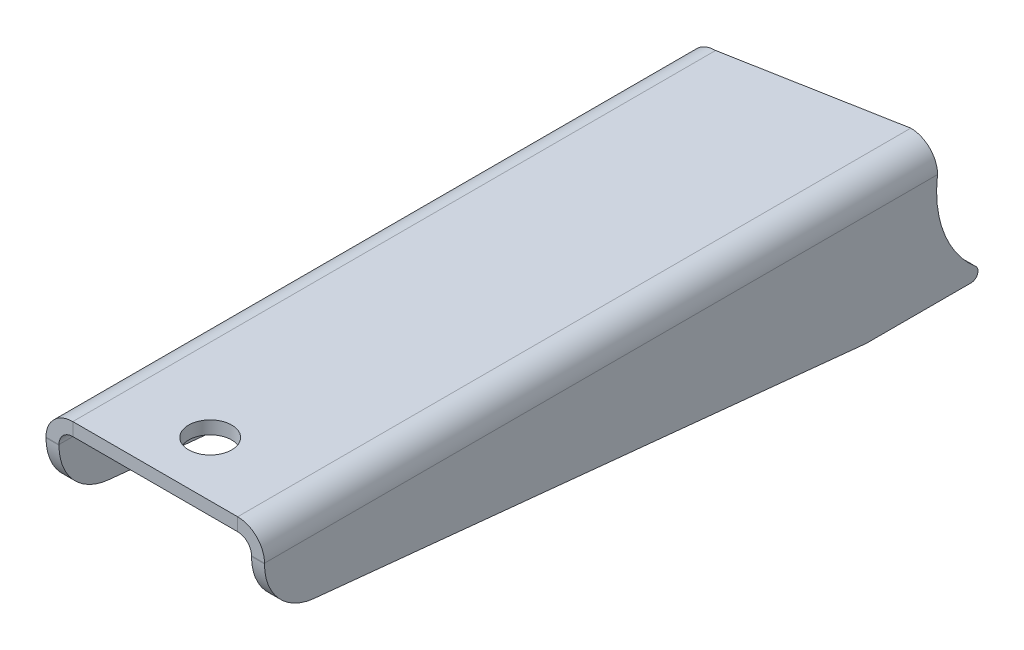
from build123d import *

# Parameters (mm, degrees)
BASE_FLANGE1_START      = -1.4986
BASE_FLANGE1_OUTLINE_W  = 19.05
BASE_FLANGE1_OUTLINE_H  = 95.25
BASE_FLANGE1_DEPTH      = 1.4986
EDGE_FLANGE2_DEPTH      = 95.25
EDGE_FLANGE2_BEND_DEPTH = 95.25
CUT_EXTRUDE2_DEPTH      = 52.76404714123502
CUT_EXTRUDE2_DEPTH_BACK = 52.76404714123502
SKETCH22_R              = 2.4892000000000007
SURFACECUT1_START       = -8.467465696
SURFACECUT1_DEPTH       = 28.142997323
CUT_EXTRUDE5_START      = -7.730915537
CUT_EXTRUDE5_DEPTH      = 7.730915537
CUT_EXTRUDE6_DEPTH      = 3.0988
CUT_EXTRUDE7_DEPTH      = 3.0988
CUT_EXTRUDE3_DEPTH      = 57.19250460256741
FILLET1_R               = 0.79375


# Read off the part's stored shape, not the designer's step: Base-Flange1, SurfaceCut1, Cut-Extrude5
# Sheet-metal steps are written as plain solids
with BuildPart() as part:
    # Base-Flange1 outline → Base-Flange1 (new body)
    with BuildSketch(Plane(origin=(0, 0, 0), x_dir=(1, 0, 0), z_dir=(0, 1, 0)).offset(BASE_FLANGE1_START)):
        Rectangle(BASE_FLANGE1_OUTLINE_W, BASE_FLANGE1_OUTLINE_H)
    extrude(amount=BASE_FLANGE1_DEPTH)

    # Edge-Flange2 section (across the edge) → Edge-Flange2 (add)
    with BuildSketch(Plane(origin=(11.125200000000007, -1.4985999999999888, -47.625), x_dir=(-1, -3.49e-15, 0), z_dir=(0, 0, 1))):
        with BuildLine():
            Line((-1.4985999999999997, 1.6002000000000056), (-1.4985999999999997, 14.3764))
            Line((-1.4985999999999997, 14.3764), (0, 14.3764))
            Line((0, 14.3764), (0, 1.6002000000000056))
            ThreePointArc((0, 1.6002000000000056), (0.46868772874528863, 0.4686877287452902), (1.6002000000000056, 5.55e-15))
            Line((1.6002000000000056, 5.55e-15), (1.600200000000011, -1.4985999999999942))
            ThreePointArc((1.600200000000011, -1.4985999999999942), (-0.5909824935408694, -0.5909824935408718), (-1.4985999999999997, 1.6002000000000056))
        make_face()
    extrude(amount=EDGE_FLANGE2_DEPTH)

    # Edge-Flange2 section 2 (across the edge) → Edge-Flange2 bend (add)
    with BuildSketch(Plane(origin=(-11.125200000000007, -1.4985999999999888, 47.625), x_dir=(1, -3.49e-15, 0), z_dir=(0, 0, -1))):
        with BuildLine():
            Line((-1.4985999999999997, 1.6002000000000056), (-1.4985999999999997, 14.3764))
            Line((-1.4985999999999997, 14.3764), (0, 14.3764))
            Line((0, 14.3764), (0, 1.6002000000000056))
            ThreePointArc((0, 1.6002000000000056), (0.46868772874528863, 0.4686877287452902), (1.6002000000000056, 5.55e-15))
            Line((1.6002000000000056, 5.55e-15), (1.600200000000011, -1.4985999999999942))
            ThreePointArc((1.600200000000011, -1.4985999999999942), (-0.5909824935408694, -0.5909824935408718), (-1.4985999999999997, 1.6002000000000056))
        make_face()
    extrude(amount=EDGE_FLANGE2_BEND_DEPTH)

    # Sketch22 → Cut-Extrude2 (cut, two sides: drawn at the far end of the back side and taken through both)
    with BuildSketch(Plane(origin=(0, 0, 0), x_dir=(1, 0, 0), z_dir=(0, 1, 0)).offset(-CUT_EXTRUDE2_DEPTH_BACK)):
        with Locations(Location((0, -41.275, 0), (0, 0, 270))):
            Circle(SKETCH22_R)
    extrude(amount=CUT_EXTRUDE2_DEPTH + CUT_EXTRUDE2_DEPTH_BACK, mode=Mode.SUBTRACT)

    # SurfaceCut1 outline → SurfaceCut1 (cut)
    with BuildSketch(Plane(origin=(0, 0, 0), x_dir=(0, 1, 0), z_dir=(0.9885166943248128, 0, -0.15111169723467696)).offset(SURFACECUT1_START)):
        with BuildLine():
            ThreePointArc((-4.7625, -28.14850854), (-11.21253157, -29.908348909), (-15.875, -34.700147478))
            Line((-15.875, -34.700147478), (-15.875, -45.396959713))
            Line((-15.875, -45.396959713), (-15.875, -48.985711411))
            Line((-15.875, -48.985711411), (-15.875, -50))
            Line((-15.875, -50), (-1.4986, -50))
            Line((-1.4986, -50), (-1.4986, -48.517446483))
            Line((-1.4986, -48.517446483), (-1.4986, -28.575083721))
            ThreePointArc((-1.4986, -28.575083721), (-3.116671212, -28.255603887), (-4.7625, -28.14850854))
        make_face()
        with BuildLine():
            ThreePointArc((4.904e-06, -29.075295425), (-0.741511706, -28.801863648), (-1.4986, -28.575083721))
            Line((-1.4986, -28.575083721), (-1.4986, -48.517446483))
            Line((-1.4986, -48.517446483), (-1.4986, -50))
            Line((-1.4986, -50), (0, -50))
            Line((0, -50), (0, -48.517446483))
            Line((0, -48.517446483), (4.904e-06, -29.075295425))
        make_face()
    extrude(amount=SURFACECUT1_DEPTH, mode=Mode.SUBTRACT)

    # Cut-Extrude5 outline → Cut-Extrude5 (cut)
    with BuildSketch(Plane(origin=(12.623799999999989, 4.417e-14, 0), x_dir=(0, 0, -1), z_dir=(1, 3.5e-15, 0)).offset(CUT_EXTRUDE5_START)):
        with BuildLine():
            Line((30.161013656, 0), (30.161013656, -3.081973107))
            add(Edge.make_bspline(
                [(30.161013656, -3.081973107), (30.123789076338376, -3.3604465015117064), (30.06785145291286, -3.91981299251284), (30.04917867771754, -4.481604272315385), (30.049178677717507, -5.901493089885278), (30.203533924549607, -7.040390278974325), (30.810097482517182, -9.23799149755241), (31.262254102606217, -10.296510885520753), (32.43252435045563, -12.258659918928036), (33.15053883450323, -13.162125608464567), (34.747119867091556, -14.697775892591103), (35.61176103928939, -15.343862250932757), (36.543461511, -15.875)],
                knots=[7.01e-15, 7.01e-15, 7.01e-15, 7.01e-15, 0.49999999999999956, 1.0000000000000067, 1.0000000000000067, 3.0274304263670744, 3.0274304263670744, 5.054860852734149, 5.054860852734149, 7.082291279101224, 7.082291279101224, 8.9752750105383, 8.9752750105383, 8.9752750105383, 8.9752750105383], degree=3))
            Line((36.543461511, -15.875), (37.033012726, -15.875))
            Line((37.033012726, -15.875), (37.033012726, 0))
            Line((37.033012726, 0), (30.161013656, 0))
        make_face()
    extrude(amount=CUT_EXTRUDE5_DEPTH, mode=Mode.SUBTRACT)

    # Sketch45 → Cut-Extrude6 (cut)
    with BuildSketch(Plane.ZY.offset(12.623799999999989)):
        with BuildLine():
            Line((-27.956993224305993, -3.333e-14), (-30.16101365632842, 9.1e-16))
            Line((-30.16101365632842, 9.1e-16), (-36.543461511337, -8e-16))
            Line((-36.543461511337, -8e-16), (-36.543461511337, -15.874999999986066))
            Line((-36.543461511337, -15.874999999986066), (-33.17348490156023, -15.875000000001156))
            add(Edge.make_bspline(
                [(-33.17348490156023, -15.875000000001156), (-26.545737514477914, -12.250087357596882), (-26.545737514477917, -4.762499999999605)],
                knots=[5.217749490668621, 5.217749490668621, 5.217749490668621, 6.283185307179613, 6.283185307179613, 6.283185307179613], degree=2, weights=[1, 0.8614298921780303, 1]))
            add(Edge.make_bspline(
                [(-26.545737514477917, -4.762499999999605), (-26.54573751447792, -3.9270502006252928), (-26.65645281584444, -3.098800000000031)],
                knots=[2.713e-14, 2.713e-14, 2.713e-14, 0.13137760520102773, 0.13137760520102773, 0.13137760520102773], degree=2, weights=[1, 0.9978432663026745, 1]))
            add(Edge.make_bspline(
                [(-26.65645281584444, -3.098800000000031), (-26.684580856749765, -2.888376912716788), (-26.720679971169147, -2.6830962290480005), (-26.807185378421263, -2.2819272788971268), (-26.85827209747719, -2.08400579105707), (-26.969891004260706, -1.7101957732584916), (-27.030292368751276, -1.5339055104769577), (-27.157879164314696, -1.2013029710556327), (-27.22503599588623, -1.045497343577505), (-27.358398930056477, -0.7651263937563396), (-27.425255566221505, -0.6388233840907098), (-27.556567938722992, -0.41451622077370254), (-27.61948989121088, -0.31919542751514146), (-27.793980163734616, -0.08637757170014503), (-27.892843777023433, -3.459e-14), (-27.956993224305993, -3.333e-14)],
                knots=[0, 0, 0, 0, 0.1249999999999998, 0.1249999999999998, 0.2499999999999996, 0.2499999999999996, 0.37499999999999944, 0.37499999999999944, 0.4999999999999992, 0.4999999999999992, 0.624999999999999, 0.624999999999999, 0.7499999999999989, 0.7499999999999989, 1, 1, 1, 1], degree=3))
        make_face()
    extrude(amount=-CUT_EXTRUDE6_DEPTH, mode=Mode.SUBTRACT)

    # Sketch46 → Cut-Extrude7 (cut)
    with BuildSketch(Plane(origin=(0, 0, 0), x_dir=(1, 0, 0), z_dir=(0, 1, 0))):
        Polygon((-11.125200000000001, 26.65645281584444), (-12.623800000000001, 26.65645281584444), (-12.623800000000044, 30.161013656328407), (9.52499999999999, 30.16101365632841), (-9.525, 26.65645281584444), align=None)
    extrude(amount=-CUT_EXTRUDE7_DEPTH, mode=Mode.SUBTRACT)

    # Sketch36 → Cut-Extrude3 (cut, through all)
    with BuildSketch(Plane.ZY.offset(12.623799999999989)):
        with BuildLine():
            Line((41.90684861578345, -9.493486157833454), (-21.593151384216544, -15.84348615783458))
            ThreePointArc((-21.593151384216544, -15.84348615783458), (-21.908682993060925, -15.867116645973631), (-22.224999999999994, -15.875000000001158))
            Line((-22.224999999999994, -15.875000000001158), (47.625, -15.875000000000039))
            Line((47.625, -15.875000000000039), (47.62499999999999, -3.1750000000000345))
            ThreePointArc((47.62499999999999, -3.1750000000000345), (45.98322358805446, -7.435883786831999), (41.90684861578345, -9.493486157833454))
        make_face()
    extrude(amount=-CUT_EXTRUDE3_DEPTH, mode=Mode.SUBTRACT)

    # Fillet1
    fillet1_edges = [part.edges().sort_by_distance(p)[0] for p in [
        (11.874500000000051, -15.874999999999957, -36.543461511),
        (-11.874500000000051, -15.875000000001114, -33.17348490156023),
    ]]
    fillet(fillet1_edges, radius=FILLET1_R)


solid = part.part
